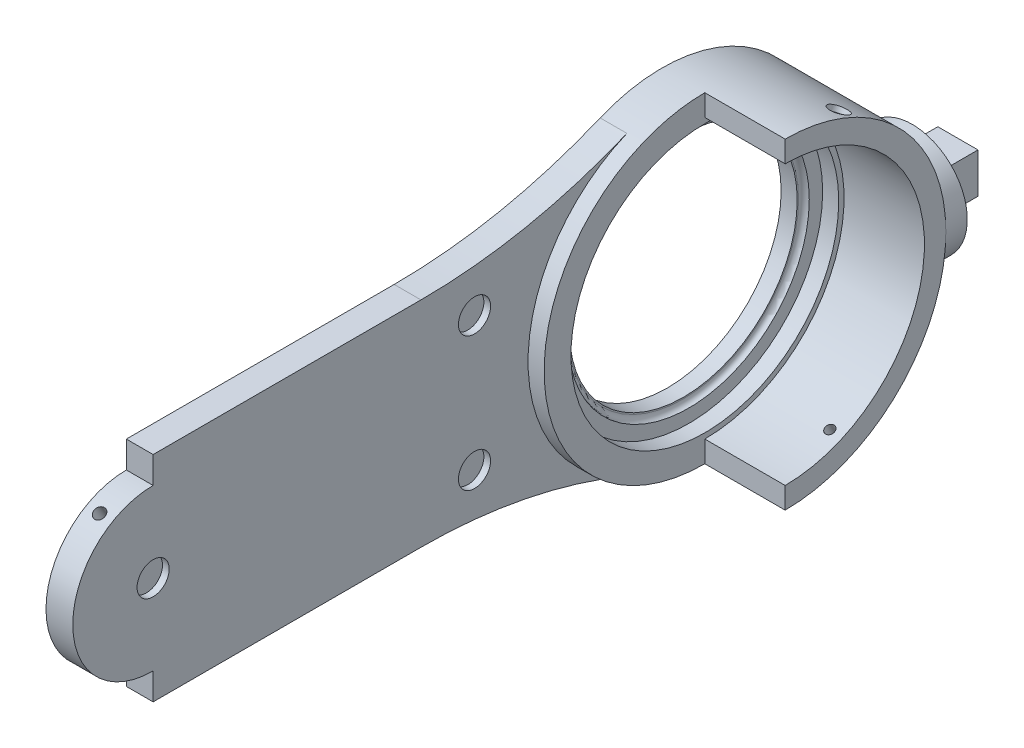
from build123d import *
from build123d.topology import SkipClean

# Parameters (mm, degrees)
SKETCH1_R                                            = 60
SKETCH1_R_2                                          = 45
SKETCH1_R_3                                          = 40.00000000000001
BOSS_EXTRUDE3_DEPTH                                  = 10
SKETCH4_R                                            = 60.00000000000001
SKETCH4_R_2                                          = 50
BOSS_EXTRUDE4_DEPTH                                  = 6
SKETCH5_R                                            = 45.00000000000001
SKETCH5_R_2                                          = 42.5
BOSS_EXTRUDE5_DEPTH                                  = 8
FILLET1_R                                            = 2
SKETCH6_R                                            = 52.5
SKETCH6_R_2                                          = 42.500000000000014
CUT_EXTRUDE2_DEPTH                                   = 2
BOSS_EXTRUDE6_DEPTH                                  = 30
BOSS_EXTRUDE7_REACH                                  = 311.38
SKETCH8_R                                            = 20.5
CUT_EXTRUDE4_DEPTH                                   = 250.99199991039714
CUT_EXTRUDE4_DEPTH_BACK                              = 250.99199991039714
BOSS_EXTRUDE8_START                                  = 8
SKETCH9_R                                            = 15
BOSS_EXTRUDE8_DEPTH                                  = 8
SKETCH12_W                                           = 14.999999999999996
SKETCH12_H                                           = 15
BOSS_EXTRUDE9_DEPTH                                  = 25
CBORE_FOR_M3_HEXAGON_HEAD_BOLTS_FULL_THR_D           = 3.4
CBORE_FOR_M3_HEXAGON_HEAD_BOLTS_FULL_THR_CBORE_D     = 7
CBORE_FOR_M3_HEXAGON_HEAD_BOLTS_FULL_THR_CBORE_DEPTH = 2
CBORE_FOR_M3_HEXAGON_HEAD_BOLTS_FULL_2_D             = 3.4
CBORE_FOR_M3_HEXAGON_HEAD_BOLTS_FULL_2_CBORE_D       = 7
CBORE_FOR_M3_HEXAGON_HEAD_BOLTS_FULL_2_CBORE_DEPTH   = 2
SKETCH14_R                                           = 2.049999999999999
CUT_EXTRUDE5_DEPTH                                   = 15
SKETCH15_R                                           = 2.0499999999999985
CUT_EXTRUDE6_DEPTH                                   = 15
SKETCH16_R                                           = 6.000000000000016
CUT_EXTRUDE7_DEPTH                                   = 2.5
SKETCH17_R                                           = 6.000000000000003
CUT_EXTRUDE8_DEPTH                                   = 2.5


with BuildPart() as part:
    # Sketch1 → Boss-Extrude3 (new body)
    # profile 1 of 3: a face of its own
    with BuildSketch(Plane(origin=(0, 0, 0), x_dir=(0, 0, -1), z_dir=(1, 0, 0))):
        Circle(SKETCH1_R)
        Circle(SKETCH1_R_2, mode=Mode.SUBTRACT)
    # profile 2 of 3: a face of its own
    with BuildSketch(Plane(origin=(0, 0, 0), x_dir=(0, 0, -1), z_dir=(1, 0, 0))):
        with BuildLine():
            ThreePointArc((-23.076923076923066, 55.38461538461536), (-60.77677297236316, 43.883864861815795), (-100, 39.99999999999997))
            Line((-100, 39.999999999999986), (-200, 39.99999999999997))
            ThreePointArc((-200, 39.999999999999986), (-171.7157287525381, 28.284271247461877), (-160, -2.449e-14))
            ThreePointArc((-160, -3.429e-14), (-171.7157287525381, -28.284271247461938), (-200, -40.00000000000003))
            Line((-200, -40.00000000000003), (-100, -40.000000000000014))
            ThreePointArc((-100, -40.00000000000003), (-60.776772972363155, -43.88386486181582), (-23.07692307692308, -55.38461538461539))
            ThreePointArc((-23.0769230769231, -55.38461538461537), (-60, 7.35e-15), (-23.076923076923073, 55.38461538461539))
        make_face()
    # profile 3 of 3: a face of its own
    with BuildSketch(Plane(origin=(0, 0, 0), x_dir=(0, 0, -1), z_dir=(1, 0, 0))):
        with Locations((-200, -2.449e-14)):
            Circle(SKETCH1_R_3)
    extrude(amount=BOSS_EXTRUDE3_DEPTH)

    # Sketch4 → Boss-Extrude4 (add)
    with BuildSketch(Plane(origin=(10, 0, 0), x_dir=(0, 0, -1), z_dir=(1, 0, 0))):
        with Locations(Location((0, 0, 0), (0, 0, 112.619864948))):
            Circle(SKETCH4_R)
        Circle(SKETCH4_R_2, mode=Mode.SUBTRACT)
    extrude(amount=BOSS_EXTRUDE4_DEPTH)

    # Sketch5 → Boss-Extrude5 (add)
    with BuildSketch(Plane.ZY):
        with Locations(Location((0, 0, 0), (0, 0, 180))):
            Circle(SKETCH5_R)
        Circle(SKETCH5_R_2, mode=Mode.SUBTRACT)
    extrude(amount=-BOSS_EXTRUDE5_DEPTH)

    # Fillet1
    fillet1_edges = [part.edges().sort_by_distance(p)[0] for p in [
        (8, -1.102e-14, 45.00000000000001),
    ]]
    fillet(fillet1_edges, radius=FILLET1_R - 0.0001)  # a hair under: the kernel refuses the full size

    # Sketch6 → Cut-Extrude2 (cut)
    with BuildSketch(Plane.ZY):
        Circle(SKETCH6_R)
        Circle(SKETCH6_R_2, mode=Mode.SUBTRACT)
    extrude(amount=-CUT_EXTRUDE2_DEPTH, mode=Mode.SUBTRACT)

    # Sketch7 → Boss-Extrude6 (add)
    with BuildSketch(Plane(origin=(16, 0, 0), x_dir=(0, 0, -1), z_dir=(1, 0, 0))):
        with BuildLine():
            ThreePointArc((60.00000000000001, -1.2e-16), (42.42640687119286, 42.42640687119285), (7.35e-15, 60.000000000000014))
            Line((0, 60.00000000000001), (0, 52.000000000000014))
            ThreePointArc((5.5e-14, 52.000000000000014), (52, -2.872e-14), (-9.55e-15, -52))
            Line((0, -52), (0, -60.00000000000001))
            ThreePointArc((0, -60), (42.42640687119285, -42.42640687119285), (60.00000000000001, -1.2e-16))
        make_face()
    extrude(amount=BOSS_EXTRUDE6_DEPTH)

    # Sketch8 → Boss-Extrude7 (add, up to next)
    with BuildSketch(Plane(origin=(0, 0, -60), x_dir=(-1, 0, 0), z_dir=(0, 0, -1)), mode=Mode.PRIVATE) as boss_extrude7_sk1:
        with Locations((-25.500000000000004, -2.72e-15)):
            Circle(SKETCH8_R)
    boss_extrude7_tool1 = extrude(boss_extrude7_sk1.sketch, amount=-BOSS_EXTRUDE7_REACH, mode=Mode.PRIVATE) - part.part
    add(boss_extrude7_tool1.solids().sort_by_distance((25.5, 0, -60))[0])
    add(boss_extrude7_tool1.solids().sort_by_distance((25.5, 0, -60))[1])

    # Sketch11 → Cut-Extrude4 (cut, two sides: drawn at the far end of the back side and taken through both)
    with BuildSketch(Plane(origin=(10, 0, 0), x_dir=(0, 0, -1), z_dir=(1, 0, 0)).offset(-CUT_EXTRUDE4_DEPTH_BACK)):
        with BuildLine():
            Line((-200, 29.999999999999975), (-200, 39.99999999999997))
            ThreePointArc((-200, 39.99999999999997), (-240, -1.959e-14), (-200, -40.00000000000003))
            Line((-200, -40.00000000000003), (-200, -30.000000000000025))
            ThreePointArc((-200, -30.000000000000025), (-230, -2.082e-14), (-200, 29.999999999999975))
        make_face()
    extrude(amount=CUT_EXTRUDE4_DEPTH + CUT_EXTRUDE4_DEPTH_BACK, mode=Mode.SUBTRACT)

    # Sketch9 → Boss-Extrude8 (add)
    with SkipClean():  # the faces are left unmerged after this step: merging them gives an invalid solid
        with BuildSketch(Plane(origin=(0, 0, -60), x_dir=(-1, 0, 0), z_dir=(0, 0, -1)).offset(BOSS_EXTRUDE8_START)):
            with BuildLine():
                ThreePointArc((-5.000000000000001, 0), (-25.500000000000007, 20.5), (-46, 0))
                ThreePointArc((-46, 0), (-25.500000000000007, -20.5), (-5.000000000000001, 0))
            make_face()
            with Locations((-25.500000000000004, -2.72e-15)):
                Circle(SKETCH9_R, mode=Mode.SUBTRACT)
        extrude(amount=-BOSS_EXTRUDE8_DEPTH)

    # Sketch12 → Boss-Extrude9 (add)
    with SkipClean():  # the faces are left unmerged after this step: merging them gives an invalid solid
        with BuildSketch(Plane(origin=(0, 0, -60), x_dir=(-1, 0, 0), z_dir=(0, 0, -1))):
            with Locations((-25.5, -3.11e-15)):
                Rectangle(SKETCH12_W, SKETCH12_H)
        extrude(amount=BOSS_EXTRUDE9_DEPTH)

    # CBORE for M3 Hexagon head bolts-Full thread-grades AB1 (through all)
    with Locations(Plane(origin=(41, -54.543560573, -25), x_dir=(0, 0.416666666667, -0.909059342886), z_dir=(0, -0.909059342886, -0.416666666667))):
        with Locations((0, 0)):
            CounterBoreHole(CBORE_FOR_M3_HEXAGON_HEAD_BOLTS_FULL_THR_D / 2, CBORE_FOR_M3_HEXAGON_HEAD_BOLTS_FULL_THR_CBORE_D / 2, CBORE_FOR_M3_HEXAGON_HEAD_BOLTS_FULL_THR_CBORE_DEPTH)

    # CBORE for M3 Hexagon head bolts-Full 2 (through all)
    with Locations(Plane(origin=(41, 54.543560573, -25), x_dir=(0, 0.416667072006, 0.909059157099), z_dir=(0, 0.909059157099, -0.416667072006))):
        with Locations((0, 0)):
            CounterBoreHole(CBORE_FOR_M3_HEXAGON_HEAD_BOLTS_FULL_2_D / 2, CBORE_FOR_M3_HEXAGON_HEAD_BOLTS_FULL_2_CBORE_D / 2, CBORE_FOR_M3_HEXAGON_HEAD_BOLTS_FULL_2_CBORE_DEPTH)

    # Sketch14 → Cut-Extrude5 (cut)
    with SkipClean():  # the faces are left unmerged after this step: merging them gives an invalid solid
        with BuildSketch(Plane(origin=(0, 119.51150572225207, 68.9999999999988), x_dir=(1, 0, 0), z_dir=(0, 0.8660254037844414, 0.49999999999999517))):
            with Locations(Location((4.999999999999994, -173.20508075688855, 0), (0, 0, 270))):
                Circle(SKETCH14_R)
        extrude(amount=-CUT_EXTRUDE5_DEPTH, mode=Mode.SUBTRACT)

    # Sketch15 → Cut-Extrude6 (cut)
    with SkipClean():  # the faces are left unmerged after this step: merging them gives an invalid solid
        with BuildSketch(Plane(origin=(0, -119.5115057222521, 68.99999999999882), x_dir=(-1, 0, 0), z_dir=(0, -0.8660254037844414, 0.49999999999999517))):
            with Locations(Location((-4.999999999999994, -173.20508075688852, 0), (0, 0, 90))):
                Circle(SKETCH15_R)
        extrude(amount=-CUT_EXTRUDE6_DEPTH, mode=Mode.SUBTRACT)

    # Sketch16 → Cut-Extrude7 (cut)
    with SkipClean():  # the faces are left unmerged after this step: merging them gives an invalid solid
        with BuildSketch(Plane(origin=(10, 0, 0), x_dir=(0, 0, -1), z_dir=(1, 0, 0))):
            with Locations((-200, 0)):
                Circle(SKETCH16_R)
        extrude(amount=-CUT_EXTRUDE7_DEPTH, mode=Mode.SUBTRACT)

    # Sketch17 → Cut-Extrude8 (cut)
    with SkipClean():  # the faces are left unmerged after this step: merging them gives an invalid solid
        with BuildSketch(Plane(origin=(10, 0, 0), x_dir=(0, 0, -1), z_dir=(1, 0, 0))):
            with Locations((-80, -25)):
                Circle(SKETCH17_R)
            with Locations((-80, 25)):
                Circle(SKETCH17_R)
        extrude(amount=-CUT_EXTRUDE8_DEPTH, mode=Mode.SUBTRACT)


solid = part.part
